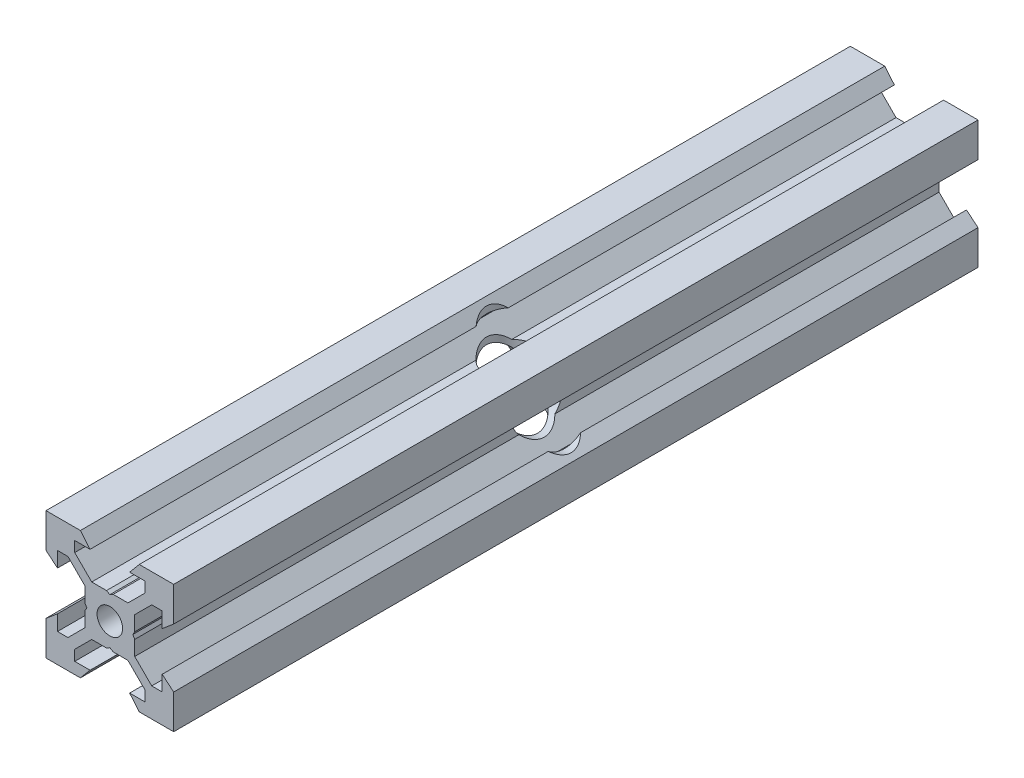
from build123d import *

# Parameters (mm, degrees)
SKETCH1_R               = 2
BOSS_EXTRUDE1_DEPTH     = 126
CUT_EXTRUDE1_DEPTH      = 127.791166885
CUT_EXTRUDE1_DEPTH_BACK = 127.791166885
SKETCH4_R               = 4
CUT_EXTRUDE2_DEPTH      = 127.791166984
CUT_EXTRUDE2_DEPTH_BACK = 127.791166984
SKETCH5_R               = 4


with BuildPart() as part:
    # Sketch1 → Boss-Extrude1 (new body)
    with BuildSketch(Plane.XY):
        Polygon((10, 4.610379336), (10, 10), (4.610379336, 10), (3.1, 8.2), (5.5, 8.2), (5.5, 6.560660172), (2.839339828, 3.9), (0.519615242, 3.9), (0, 3.6), (-0.519615242, 3.9), (-2.839339828, 3.9), (-5.5, 6.560660172), (-5.5, 8.2), (-3.1, 8.2), (-4.610379336, 10), (-10, 10), (-10, 4.610379336), (-8.2, 3.1), (-8.2, 5.5), (-6.560660172, 5.5), (-3.9, 2.839339828), (-3.9, 0.519615242), (-3.6, 0), (-3.9, -0.519615242), (-3.9, -2.839339828), (-6.560660172, -5.5), (-8.2, -5.5), (-8.2, -3.1), (-10, -4.610379336), (-10, -10), (-4.610379336, -10), (-3.1, -8.2), (-5.5, -8.2), (-5.5, -6.560660172), (-2.839339828, -3.9), (-0.519615242, -3.9), (0, -3.6), (0.519615242, -3.9), (2.839339828, -3.9), (5.5, -6.560660172), (5.5, -8.2), (3.1, -8.2), (4.610379336, -10), (10, -10), (10, -4.610379336), (8.2, -3.1), (8.2, -5.5), (6.560660172, -5.5), (3.9, -2.839339828), (3.9, -0.519615242), (3.6, 0), (3.9, 0.519615242), (3.9, 2.839339828), (6.560660172, 5.5), (8.2, 5.5), (8.2, 3.1), align=None)
        Circle(SKETCH1_R, mode=Mode.SUBTRACT)
    extrude(amount=BOSS_EXTRUDE1_DEPTH)

    # Sketch4 → Cut-Extrude1 (cut, two sides: drawn at the far end of the back side and taken through both)
    with BuildSketch(Plane(origin=(0, 0, 0), x_dir=(0, 0, -1), z_dir=(1, 0, 0)).offset(-CUT_EXTRUDE1_DEPTH_BACK)):
        with Locations((-63, 0)):
            Circle(SKETCH4_R)
    extrude(amount=CUT_EXTRUDE1_DEPTH + CUT_EXTRUDE1_DEPTH_BACK, mode=Mode.SUBTRACT)

    # Sketch5 → Cut-Extrude2 (cut, two sides: drawn at the far end of the back side and taken through both)
    with BuildSketch(Plane(origin=(0, 0, 0), x_dir=(1, 0, 0), z_dir=(0, 1, 0)).offset(-CUT_EXTRUDE2_DEPTH_BACK)):
        with Locations((0, -63)):
            Circle(SKETCH5_R)
    extrude(amount=CUT_EXTRUDE2_DEPTH + CUT_EXTRUDE2_DEPTH_BACK, mode=Mode.SUBTRACT)


solid = part.part
